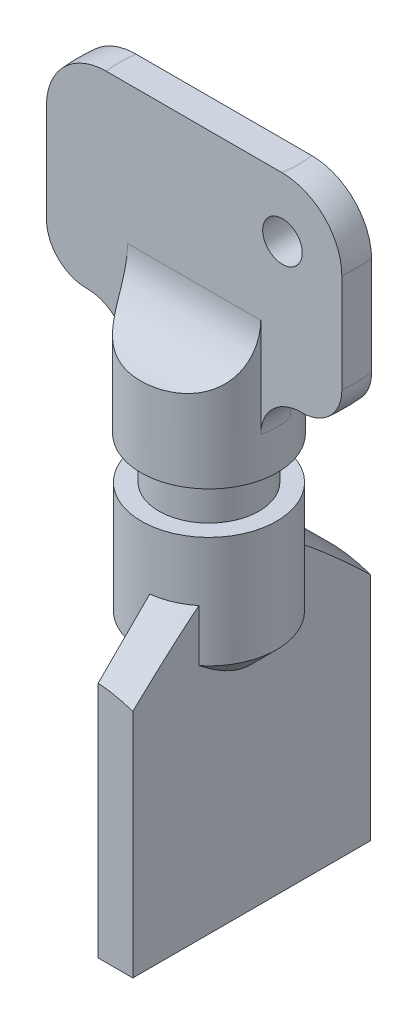
from build123d import *

# Parameters (mm, degrees)
BOSS_EXTRUDE1_DEPTH      = 10
FILLET2_R                = 2
FILLET3_R                = 3
CUT_EXTRUDE1_DEPTH       = 49.473897211
CUT_EXTRUDE1_DEPTH_BACK  = 49.473897211
SKETCH3_R                = 1
BOSS_EXTRUDE2_DEPTH      = 6
BOSS_EXTRUDE2_DEPTH_BACK = 6
SKETCH4_W                = 1.75
SKETCH4_H                = 11.625349657
CHAMFER1_SIZE            = 3
CHAMFER2_SIZE            = 3


with BuildPart() as part:
    # Sketch1 → Revolve1 (revolve)
    with BuildSketch(Plane.XY):
        Polygon((-3.448914015, 37.765821371), (-3.448914015, 33.765821371), (-2.534753992, 33.765821371), (-2.534753992, 31.624967984), (-3.41766068, 31.624967984), (-3.41766068, 23), (0, 23), (0, 37.765821371), align=None)
    revolve(axis=Axis((0, 37.765821371, 0), (0, -1, 0)))

    # Sketch2 → Boss-Extrude1 (add)
    with BuildSketch(Plane(origin=(0, 37.765821371, 0), x_dir=(1, 0, 0), z_dir=(0, 1, 0))):
        with BuildLine():
            Line((3.366379046, 0.75), (-3.366379046, 0.75))
            ThreePointArc((-3.366379046, 0.75), (-3.448914015, 0), (-3.366379046, -0.75))
            Line((-3.366379046, -0.75), (3.366379046, -0.75))
            ThreePointArc((3.366379046, -0.75), (3.428218178, -0.37726384), (3.448914015, 0))
            ThreePointArc((3.448914015, 0), (3.428218178, 0.37726384), (3.366379046, 0.75))
        make_face()
        with BuildLine():
            Line((-3.366379046, 0.75), (-7.462405778, 0.75))
            ThreePointArc((-7.462405778, 0.75), (-7.5, 0), (-7.462405778, -0.75))
            Line((-7.462405778, -0.75), (-3.366379046, -0.75))
            ThreePointArc((-3.366379046, -0.75), (-3.448914015, 0), (-3.366379046, 0.75))
        make_face()
        with BuildLine():
            ThreePointArc((7.5, 0), (7.490595548, 0.375470813), (7.462405778, 0.75))
            Line((7.462405778, 0.75), (3.366379046, 0.75))
            ThreePointArc((3.366379046, 0.75), (3.428218178, 0.37726384), (3.448914015, 0))
            ThreePointArc((3.448914015, 0), (3.428218178, -0.37726384), (3.366379046, -0.75))
            Line((3.366379046, -0.75), (7.462405778, -0.75))
            ThreePointArc((7.462405778, -0.75), (7.490595548, -0.375470813), (7.5, 0))
        make_face()
    extrude(amount=BOSS_EXTRUDE1_DEPTH)

    # Fillet2
    # the kernel refuses this fillet: 2 mm, written as the material it adds along each edge
    with BuildSketch(Plane(origin=(0, 37.765821371, 0), x_dir=(-0.09803421101524086, 0, -0.9951830452085783), z_dir=(-0.9951830452085783, 0, 0.09803421101524086))) as fillet2_piece_1_section:
        with BuildLine():
            CenterArc((3.448914015 + FILLET2_R, FILLET2_R), FILLET2_R, 180, 90)
            Line((3.448914015 + FILLET2_R, 0), (3.448914015, 0))
            Line((3.448914015, 0), (3.448914015, FILLET2_R))
        make_face()
    fillet2_piece_1 = revolve(axis=Axis((0, 37.765821371, 0), (0, -1, 0)), revolution_arc=191.251965623, mode=Mode.PRIVATE)
    fillet2_piece_1 = split(fillet2_piece_1, bisect_by=Plane(origin=(3.870689991, 37.318827735, -0.75), z_dir=(0, 0, 1)), keep=Keep.TOP, mode=Mode.PRIVATE)
    fillet2_piece_1 = split(fillet2_piece_1, bisect_by=Plane(origin=(3.870689991, 37.318827735, 0.75), z_dir=(0, 0, -1)), keep=Keep.TOP, mode=Mode.PRIVATE)
    add(fillet2_piece_1)
    with BuildSketch(Plane(origin=(0, 37.765821371, 0), x_dir=(0.09800035789508027, 0, 0.9951863794548418), z_dir=(0.9951863794548418, 0, -0.09800035789508027))) as fillet2_piece_2_section:
        with BuildLine():
            CenterArc((3.448914015 + FILLET2_R, FILLET2_R), FILLET2_R, 180, 90)
            Line((3.448914015 + FILLET2_R, 0), (3.448914015, 0))
            Line((3.448914015, 0), (3.448914015, FILLET2_R))
        make_face()
    fillet2_piece_2 = revolve(axis=Axis((0, 37.765821371, 0), (0, -1, 0)), revolution_arc=95.624033786, mode=Mode.PRIVATE)
    fillet2_piece_2 = split(fillet2_piece_2, bisect_by=Plane(origin=(-3.870690025, 37.318827894, 0.75), z_dir=(0, 0, -1)), keep=Keep.TOP, mode=Mode.PRIVATE)
    add(fillet2_piece_2)
    with BuildSketch(Plane(origin=(0, 37.765821371, 0), x_dir=(-1, 0, 0), z_dir=(0, 0, 1))) as fillet2_piece_3_section:
        with BuildLine():
            CenterArc((3.448914015 + FILLET2_R, FILLET2_R), FILLET2_R, 180, 90)
            Line((3.448914015 + FILLET2_R, 0), (3.448914015, 0))
            Line((3.448914015, 0), (3.448914015, FILLET2_R))
        make_face()
    fillet2_piece_3 = revolve(axis=Axis((0, 37.765821371, 0), (0, -1, 0)), revolution_arc=95.624033786, mode=Mode.PRIVATE)
    fillet2_piece_3 = split(fillet2_piece_3, bisect_by=Plane(origin=(-3.870689874, 37.318828004, -0.75), z_dir=(0, 0, 1)), keep=Keep.TOP, mode=Mode.PRIVATE)
    add(fillet2_piece_3)
    # the kernel refuses this fillet: 2 mm, written as the material it takes off along each edge
    with BuildSketch(Plane(origin=(0, 37.765821371, 0), x_dir=(-0.7201079494948177, 0, -0.6938620475817721), z_dir=(0.6938620475817721, 0, -0.7201079494948177))) as fillet2_2_piece_1:
        with BuildLine():
            CenterArc((7.5 - FILLET2_R, FILLET2_R), FILLET2_R, 270, 90)
            Line((7.5, FILLET2_R), (7.5, 0))
            Line((7.5, 0), (7.5 - FILLET2_R, 0))
        make_face()
    revolve(axis=Axis((0, 37.765821371, 0), (0, 1, 0)), revolution_arc=87.873212667, mode=Mode.SUBTRACT)
    with BuildSketch(Plane(origin=(0, 37.765821371, 0), x_dir=(0.7201079494948216, 0, 0.6938620475817678), z_dir=(-0.6938620475817678, 0, 0.7201079494948216))) as fillet2_2_piece_2:
        with BuildLine():
            CenterArc((7.5 - FILLET2_R, FILLET2_R), FILLET2_R, 270, 90)
            Line((7.5 - FILLET2_R, 0), (7.5, 0))
            Line((7.5, 0), (7.5, FILLET2_R))
        make_face()
    revolve(axis=Axis((0, 37.765821371, 0), (0, 1, 0)), revolution_arc=87.873212667, mode=Mode.SUBTRACT)

    # Fillet3
    # the kernel refuses this fillet: 3 mm, written as the material it adds along each edge
    with BuildSketch(Plane(origin=(10.866379046, 37.765821371, -0.75), x_dir=(0, 1, 0), z_dir=(-1, 0, 0))) as fillet3_piece_1_section:
        with BuildLine():
            CenterArc((FILLET3_R, FILLET3_R), FILLET3_R, 180, 90)
            Line((0, FILLET3_R), (0, 0))
            Line((0, 0), (FILLET3_R, 0))
        make_face()
    fillet3_piece_1 = extrude(amount=21.732758092, mode=Mode.PRIVATE)
    fillet3_piece_1 = fillet3_piece_1 & Plane(origin=(0, 38.470226203, 0), x_dir=(-1, 0, 0), z_dir=(0, -1, 0)) * Cylinder(3.448914015, 56, mode=Mode.PRIVATE)
    add(fillet3_piece_1)
    with BuildSketch(Plane(origin=(10.866379046, 37.765821371, 0.75), x_dir=(0, 1, 0), z_dir=(-1, 0, 0))) as fillet3_piece_2_section:
        with BuildLine():
            CenterArc((FILLET3_R, -FILLET3_R), FILLET3_R, 90, 90)
            Line((0, -FILLET3_R), (0, 0))
            Line((0, 0), (FILLET3_R, 0))
        make_face()
    fillet3_piece_2 = extrude(amount=21.732758092, mode=Mode.PRIVATE)
    fillet3_piece_2 = fillet3_piece_2 & Plane(origin=(0, 38.470226203, 0), x_dir=(-1, 0, 0), z_dir=(0, -1, 0)) * Cylinder(3.448914015, 56, mode=Mode.PRIVATE)
    add(fillet3_piece_2)
    # the kernel refuses this fillet: 3 mm, written as the material it takes off along each edge
    with BuildSketch(Plane(origin=(0, 47.765821371, 0), x_dir=(-0.4534410859899706, 0, -0.8912862511764871), z_dir=(0.8912862511764871, 0, -0.4534410859899706))) as fillet3_2_piece_1:
        with BuildLine():
            CenterArc((7.5 - FILLET3_R, -FILLET3_R), FILLET3_R, 0, 90)
            Line((7.5 - FILLET3_R, 0), (7.5, 0))
            Line((7.5, 0), (7.5, -FILLET3_R))
        make_face()
    revolve(axis=Axis((0, 47.765821371, 0), (0, 1, 0)), revolution_arc=126.070648523, mode=Mode.SUBTRACT)
    with BuildSketch(Plane(origin=(0, 47.765821371, 0), x_dir=(0.4534410859901425, 0, -0.8912862511763997), z_dir=(-0.8912862511763997, 0, -0.4534410859901425))) as fillet3_2_piece_2:
        with BuildLine():
            CenterArc((7.5 - FILLET3_R, FILLET3_R), FILLET3_R, 270, 90)
            Line((7.5, FILLET3_R), (7.5, 0))
            Line((7.5, 0), (7.5 - FILLET3_R, 0))
        make_face()
    revolve(axis=Axis((0, 47.765821371, 0), (0, -1, 0)), revolution_arc=126.070648523, mode=Mode.SUBTRACT)

    # Sketch3 → Cut-Extrude1 (cut, two sides: drawn at the far end of the back side and taken through both)
    with BuildSketch(Plane.XY.offset(-CUT_EXTRUDE1_DEPTH_BACK)):
        with Locations((4.462405778, 44.765821371)):
            Circle(SKETCH3_R)
    extrude(amount=CUT_EXTRUDE1_DEPTH + CUT_EXTRUDE1_DEPTH_BACK, mode=Mode.SUBTRACT)

    # Sketch4 → Boss-Extrude2 (add, two sides: drawn at the far end of the back side and taken through both)
    with BuildSketch(Plane.XY.offset(-BOSS_EXTRUDE2_DEPTH_BACK)):
        with Locations((1.275, 19.812674829)):
            Rectangle(SKETCH4_W, SKETCH4_H)
    extrude(amount=BOSS_EXTRUDE2_DEPTH + BOSS_EXTRUDE2_DEPTH_BACK)

    # Chamfer1
    # the kernel refuses this chamfer: 3 mm, written as the material it adds along each edge
    with BuildSketch(Plane(origin=(0, 25.625349657, 0), x_dir=(0.20228823053710607, 0, -0.9793260293621153), z_dir=(-0.9793260293621153, 0, -0.20228823053710607))) as chamfer1_piece_1_section:
        Polygon((3.41766068, -CHAMFER1_SIZE), (3.41766068 + CHAMFER1_SIZE, 0), (3.41766068, 0), align=None)
    chamfer1_piece_1 = revolve(axis=Axis((0, 25.625349657, 0), (0, -1, 0)), revolution_arc=290.954478768, mode=Mode.PRIVATE)
    chamfer1_piece_1 = split(chamfer1_piece_1, bisect_by=Plane(origin=(0.4, 26.674438402, -4.015172559), z_dir=(1, 0, 0)), keep=Keep.TOP, mode=Mode.PRIVATE)
    chamfer1_piece_1 = split(chamfer1_piece_1, bisect_by=Plane(origin=(2.15, 26.674438402, -4.015172559), z_dir=(-1, 0, 0)), keep=Keep.TOP, mode=Mode.PRIVATE)
    chamfer1_piece_1 = split(chamfer1_piece_1, bisect_by=Plane(origin=(1.527141466, 26.674438402, -6), z_dir=(0, 0, 1)), keep=Keep.TOP, mode=Mode.PRIVATE)
    chamfer1_piece_1 = split(chamfer1_piece_1, bisect_by=Plane(origin=(1.527141466, 26.674438402, 6), z_dir=(0, 0, -1)), keep=Keep.TOP, mode=Mode.PRIVATE)
    add(chamfer1_piece_1)
    with BuildSketch(Plane(origin=(0, 25.625349657, 0), x_dir=(-0.8422146057104749, 0, 0.5391424282394677), z_dir=(0.5391424282394677, 0, 0.8422146057104749))) as chamfer1_piece_2_section:
        Polygon((3.41766068, -CHAMFER1_SIZE), (3.41766068 + CHAMFER1_SIZE, 0), (3.41766068, 0), align=None)
    chamfer1_piece_2 = revolve(axis=Axis((0, 25.625349657, 0), (0, -1, 0)), revolution_arc=290.954478768, mode=Mode.PRIVATE)
    chamfer1_piece_2 = split(chamfer1_piece_2, bisect_by=Plane(origin=(0.4, 26.639588442, -4.151887782), z_dir=(1, 0, 0)), keep=Keep.TOP, mode=Mode.PRIVATE)
    chamfer1_piece_2 = split(chamfer1_piece_2, bisect_by=Plane(origin=(2.15, 26.639588442, -4.151887782), z_dir=(-1, 0, 0)), keep=Keep.TOP, mode=Mode.PRIVATE)
    chamfer1_piece_2 = split(chamfer1_piece_2, bisect_by=Plane(origin=(1.298873136, 26.639588442, -6), z_dir=(0, 0, 1)), keep=Keep.TOP, mode=Mode.PRIVATE)
    chamfer1_piece_2 = split(chamfer1_piece_2, bisect_by=Plane(origin=(1.298873136, 26.639588442, 6), z_dir=(0, 0, -1)), keep=Keep.TOP, mode=Mode.PRIVATE)
    add(chamfer1_piece_2)

    # Chamfer2
    # the kernel refuses this chamfer: 3 mm, written as the material it takes off along each edge
    with BuildSketch(Plane(origin=(0, 23, 0), x_dir=(-0.9999950652018582, 0, -0.003141587485879368), z_dir=(-0.003141587485879368, 0, 0.9999950652018582))) as chamfer2_piece_1_section:
        Polygon((3.41766068 - CHAMFER2_SIZE, 0), (3.41766068, -CHAMFER2_SIZE), (3.41766068, 0), align=None)
    chamfer2_piece_1 = revolve(axis=Axis((0, 23, 0), (0, -1, 0)), revolution_arc=359.64, mode=Mode.PRIVATE)
    chamfer2_piece_1 = split(chamfer2_piece_1, bisect_by=Plane(origin=(0.4, 23.418910756, -0.767888946), z_dir=(-1, 0, 0)), keep=Keep.TOP, mode=Mode.PRIVATE)
    add(chamfer2_piece_1, mode=Mode.SUBTRACT)
    with BuildSketch(Plane(origin=(0, 23, 0), x_dir=(-0.9999950652018582, 0, -0.003141587485879368), z_dir=(-0.003141587485879368, 0, 0.9999950652018582))) as chamfer2_piece_2_section:
        Polygon((3.41766068 - CHAMFER2_SIZE, 0), (3.41766068, -CHAMFER2_SIZE), (3.41766068, 0), align=None)
    chamfer2_piece_2 = revolve(axis=Axis((0, 23, 0), (0, -1, 0)), revolution_arc=359.64, mode=Mode.PRIVATE)
    chamfer2_piece_2 = split(chamfer2_piece_2, bisect_by=Plane(origin=(2.15, 24.31046368, -3e-09), z_dir=(1, 0, 0)), keep=Keep.TOP, mode=Mode.PRIVATE)
    add(chamfer2_piece_2, mode=Mode.SUBTRACT)
    with BuildSketch(Plane(origin=(0, 23, 0), x_dir=(-1, 0, 0), z_dir=(0, 0, 1))) as chamfer2_piece_3_section:
        Polygon((3.41766068, -CHAMFER2_SIZE), (3.41766068 - CHAMFER2_SIZE, 0), (3.41766068, 0), align=None)
    chamfer2_piece_3 = revolve(axis=Axis((0, 23, 0), (0, -1, 0)), revolution_arc=226.121119214, mode=Mode.PRIVATE)
    chamfer2_piece_3 = split(chamfer2_piece_3, bisect_by=Plane(origin=(0.4, 24.102417014, -1.763188428), z_dir=(-1, 0, 0)), keep=Keep.TOP, mode=Mode.PRIVATE)
    add(chamfer2_piece_3, mode=Mode.SUBTRACT)
    with BuildSketch(Plane(origin=(0, 23, 0), x_dir=(-1, 0, 0), z_dir=(0, 0, 1))) as chamfer2_piece_4_section:
        Polygon((3.41766068, -CHAMFER2_SIZE), (3.41766068 - CHAMFER2_SIZE, 0), (3.41766068, 0), align=None)
    chamfer2_piece_4 = revolve(axis=Axis((0, 23, 0), (0, -1, 0)), revolution_arc=226.121119214, mode=Mode.PRIVATE)
    chamfer2_piece_4 = split(chamfer2_piece_4, bisect_by=Plane(origin=(2.15, 24.306348472, -0.040273497), z_dir=(1, 0, 0)), keep=Keep.TOP, mode=Mode.PRIVATE)
    add(chamfer2_piece_4, mode=Mode.SUBTRACT)
    with BuildSketch(Plane(origin=(0, 23, 0), x_dir=(0.6931361861639339, 0, -0.7208066505174022), z_dir=(-0.7208066505174022, 0, -0.6931361861639339))) as chamfer2_piece_5_section:
        Polygon((3.41766068, -CHAMFER2_SIZE), (3.41766068 - CHAMFER2_SIZE, 0), (3.41766068, 0), align=None)
    chamfer2_piece_5 = revolve(axis=Axis((0, 23, 0), (0, -1, 0)), revolution_arc=226.121119214, mode=Mode.PRIVATE)
    chamfer2_piece_5 = split(chamfer2_piece_5, bisect_by=Plane(origin=(2.15, 24.306348462, 0.040273494), z_dir=(1, 0, 0)), keep=Keep.TOP, mode=Mode.PRIVATE)
    add(chamfer2_piece_5, mode=Mode.SUBTRACT)
    with BuildSketch(Plane(origin=(0, 23, 0), x_dir=(0.6931361861639339, 0, -0.7208066505174022), z_dir=(-0.7208066505174022, 0, -0.6931361861639339))) as chamfer2_piece_6_section:
        Polygon((3.41766068, -CHAMFER2_SIZE), (3.41766068 - CHAMFER2_SIZE, 0), (3.41766068, 0), align=None)
    chamfer2_piece_6 = revolve(axis=Axis((0, 23, 0), (0, -1, 0)), revolution_arc=226.121119214, mode=Mode.PRIVATE)
    chamfer2_piece_6 = split(chamfer2_piece_6, bisect_by=Plane(origin=(0.4, 24.102417086, 1.763188451), z_dir=(-1, 0, 0)), keep=Keep.TOP, mode=Mode.PRIVATE)
    add(chamfer2_piece_6, mode=Mode.SUBTRACT)


solid = part.part
